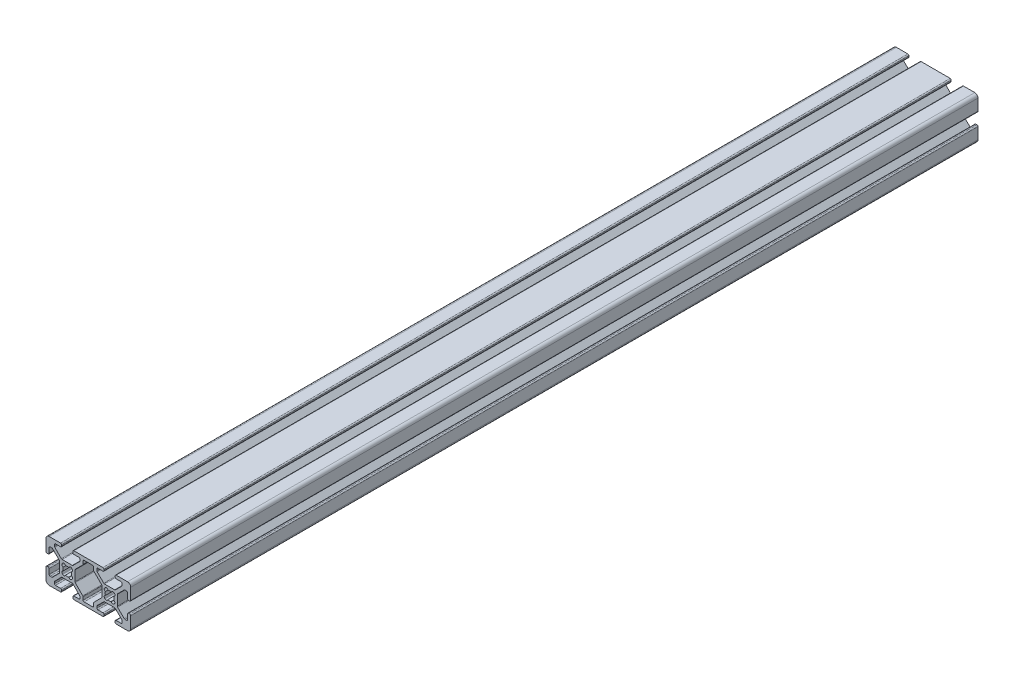
from build123d import *

# Parameters (mm, degrees)
EXTRUDE1_DEPTH = 400


with BuildPart() as part:
    # Sketch1 → Extrude1 (new body)
    with BuildSketch(Plane.XY):
        with BuildLine():
            Line((-22.383919339, -3.655), (-17.616080661, -3.655))
            ThreePointArc((-17.616080661, -3.655), (-17.421677478, -3.693669197), (-17.256870417, -3.803789755))
            Line((-17.256870417, -3.803789755), (-14.153789755, -6.906870417))
            ThreePointArc((-14.153789755, -6.906870417), (-14.043669197, -7.071677478), (-14.005, -7.266080661))
            Line((-14.005, -7.266080661), (-14.005, -7.992))
            ThreePointArc((-14.005, -7.992), (-14.153789755, -8.351210245), (-14.513, -8.5))
            Line((-14.513, -8.5), (-16.862, -8.5))
            ThreePointArc((-16.862, -8.5), (-17.221210245, -8.648789755), (-17.37, -9.008))
            Line((-17.37, -9.008), (-17.37, -9.492))
            ThreePointArc((-17.37, -9.492), (-17.221210245, -9.851210245), (-16.862, -10))
            Line((-16.862, -10), (-3.138, -10))
            ThreePointArc((-3.138, -10), (-2.778789755, -9.851210245), (-2.63, -9.492))
            Line((-2.63, -9.492), (-2.63, -9.008))
            ThreePointArc((-2.63, -9.008), (-2.778789755, -8.648789755), (-3.138, -8.5))
            Line((-3.138, -8.5), (-5.487, -8.5))
            ThreePointArc((-5.487, -8.5), (-5.846210245, -8.351210245), (-5.995, -7.992))
            Line((-5.995, -7.992), (-5.995, -7.266080661))
            ThreePointArc((-5.995, -7.266080661), (-5.956330803, -7.071677478), (-5.846210245, -6.906870417))
            Line((-5.846210245, -6.906870417), (-2.743129583, -3.803789755))
            ThreePointArc((-2.743129583, -3.803789755), (-2.578322522, -3.693669197), (-2.383919339, -3.655))
            Line((-2.383919339, -3.655), (2.383919339, -3.655))
            ThreePointArc((2.383919339, -3.655), (2.578322522, -3.693669197), (2.743129583, -3.803789755))
            Line((2.743129583, -3.803789755), (5.846210245, -6.906870417))
            ThreePointArc((5.846210245, -6.906870417), (5.956330803, -7.071677478), (5.995, -7.266080661))
            Line((5.995, -7.266080661), (5.995, -7.992))
            ThreePointArc((5.995, -7.992), (5.846210245, -8.351210245), (5.487, -8.5))
            Line((5.487, -8.5), (3.138, -8.5))
            ThreePointArc((3.138, -8.5), (2.778789755, -8.648789755), (2.63, -9.008))
            Line((2.63, -9.008), (2.63, -9.492))
            ThreePointArc((2.63, -9.492), (2.778789755, -9.851210245), (3.138, -10))
            Line((3.138, -10), (8.5, -10))
            ThreePointArc((8.5, -10), (9.560660172, -9.560660172), (10, -8.5))
            Line((10, -8.5), (10, -3.138))
            ThreePointArc((10, -3.138), (9.851210245, -2.778789755), (9.492, -2.63))
            Line((9.492, -2.63), (9.008, -2.63))
            ThreePointArc((9.008, -2.63), (8.648789755, -2.778789755), (8.5, -3.138))
            Line((8.5, -3.138), (8.5, -5.487))
            ThreePointArc((8.5, -5.487), (8.351210245, -5.846210245), (7.992, -5.995))
            Line((7.992, -5.995), (7.266080661, -5.995))
            ThreePointArc((7.266080661, -5.995), (7.071677478, -5.956330803), (6.906870417, -5.846210245))
            Line((6.906870417, -5.846210245), (3.803789755, -2.743129583))
            ThreePointArc((3.803789755, -2.743129583), (3.693669197, -2.578322522), (3.655, -2.383919339))
            Line((3.655, -2.383919339), (3.655, 2.383919339))
            ThreePointArc((3.655, 2.383919339), (3.693669197, 2.578322522), (3.803789755, 2.743129583))
            Line((3.803789755, 2.743129583), (6.906870417, 5.846210245))
            ThreePointArc((6.906870417, 5.846210245), (7.071677478, 5.956330803), (7.266080661, 5.995))
            Line((7.266080661, 5.995), (7.992, 5.995))
            ThreePointArc((7.992, 5.995), (8.351210245, 5.846210245), (8.5, 5.487))
            Line((8.5, 5.487), (8.5, 3.138))
            ThreePointArc((8.5, 3.138), (8.648789755, 2.778789755), (9.008, 2.63))
            Line((9.008, 2.63), (9.492, 2.63))
            ThreePointArc((9.492, 2.63), (9.851210245, 2.778789755), (10, 3.138))
            Line((10, 3.138), (10, 8.5))
            ThreePointArc((10, 8.5), (9.560660172, 9.560660172), (8.5, 10))
            Line((8.5, 10), (3.138, 10))
            ThreePointArc((3.138, 10), (2.778789755, 9.851210245), (2.63, 9.492))
            Line((2.63, 9.492), (2.63, 9.008))
            ThreePointArc((2.63, 9.008), (2.778789755, 8.648789755), (3.138, 8.5))
            Line((3.138, 8.5), (5.487, 8.5))
            ThreePointArc((5.487, 8.5), (5.846210245, 8.351210245), (5.995, 7.992))
            Line((5.995, 7.992), (5.995, 7.266080661))
            ThreePointArc((5.995, 7.266080661), (5.956330803, 7.071677478), (5.846210245, 6.906870417))
            Line((5.846210245, 6.906870417), (2.743129583, 3.803789755))
            ThreePointArc((2.743129583, 3.803789755), (2.578322522, 3.693669197), (2.383919339, 3.655))
            Line((2.383919339, 3.655), (-2.383919339, 3.655))
            ThreePointArc((-2.383919339, 3.655), (-2.578322522, 3.693669197), (-2.743129583, 3.803789755))
            Line((-2.743129583, 3.803789755), (-5.846210245, 6.906870417))
            ThreePointArc((-5.846210245, 6.906870417), (-5.956330803, 7.071677478), (-5.995, 7.266080661))
            Line((-5.995, 7.266080661), (-5.995, 7.992))
            ThreePointArc((-5.995, 7.992), (-5.846210245, 8.351210245), (-5.487, 8.5))
            Line((-5.487, 8.5), (-3.138, 8.5))
            ThreePointArc((-3.138, 8.5), (-2.778789755, 8.648789755), (-2.63, 9.008))
            Line((-2.63, 9.008), (-2.63, 9.492))
            ThreePointArc((-2.63, 9.492), (-2.778789755, 9.851210245), (-3.138, 10))
            Line((-3.138, 10), (-16.862, 10))
            ThreePointArc((-16.862, 10), (-17.221210245, 9.851210245), (-17.37, 9.492))
            Line((-17.37, 9.492), (-17.37, 9.008))
            ThreePointArc((-17.37, 9.008), (-17.221210245, 8.648789755), (-16.862, 8.5))
            Line((-16.862, 8.5), (-14.513, 8.5))
            ThreePointArc((-14.513, 8.5), (-14.153789755, 8.351210245), (-14.005, 7.992))
            Line((-14.005, 7.992), (-14.005, 7.266080661))
            ThreePointArc((-14.005, 7.266080661), (-14.043669197, 7.071677478), (-14.153789755, 6.906870417))
            Line((-14.153789755, 6.906870417), (-17.256870417, 3.803789755))
            ThreePointArc((-17.256870417, 3.803789755), (-17.421677478, 3.693669197), (-17.616080661, 3.655))
            Line((-17.616080661, 3.655), (-22.383919339, 3.655))
            ThreePointArc((-22.383919339, 3.655), (-22.578322522, 3.693669197), (-22.743129583, 3.803789755))
            Line((-22.743129583, 3.803789755), (-25.846210245, 6.906870417))
            ThreePointArc((-25.846210245, 6.906870417), (-25.956330803, 7.071677478), (-25.995, 7.266080661))
            Line((-25.995, 7.266080661), (-25.995, 7.992))
            ThreePointArc((-25.995, 7.992), (-25.846210245, 8.351210245), (-25.487, 8.5))
            Line((-25.487, 8.5), (-23.138, 8.5))
            ThreePointArc((-23.138, 8.5), (-22.778789755, 8.648789755), (-22.63, 9.008))
            Line((-22.63, 9.008), (-22.63, 9.492))
            ThreePointArc((-22.63, 9.492), (-22.778789755, 9.851210245), (-23.138, 10))
            Line((-23.138, 10), (-28.5, 10))
            ThreePointArc((-28.5, 10), (-29.560660172, 9.560660172), (-30, 8.5))
            Line((-30, 8.5), (-30, 3.138))
            ThreePointArc((-30, 3.138), (-29.851210245, 2.778789755), (-29.492, 2.63))
            Line((-29.492, 2.63), (-29.008, 2.63))
            ThreePointArc((-29.008, 2.63), (-28.648789755, 2.778789755), (-28.5, 3.138))
            Line((-28.5, 3.138), (-28.5, 5.487))
            ThreePointArc((-28.5, 5.487), (-28.351210245, 5.846210245), (-27.992, 5.995))
            Line((-27.992, 5.995), (-27.266080661, 5.995))
            ThreePointArc((-27.266080661, 5.995), (-27.071677478, 5.956330803), (-26.906870417, 5.846210245))
            Line((-26.906870417, 5.846210245), (-23.803789755, 2.743129583))
            ThreePointArc((-23.803789755, 2.743129583), (-23.693669197, 2.578322522), (-23.655, 2.383919339))
            Line((-23.655, 2.383919339), (-23.655, -2.383919339))
            ThreePointArc((-23.655, -2.383919339), (-23.693669197, -2.578322522), (-23.803789755, -2.743129583))
            Line((-23.803789755, -2.743129583), (-26.906870417, -5.846210245))
            ThreePointArc((-26.906870417, -5.846210245), (-27.071677478, -5.956330803), (-27.266080661, -5.995))
            Line((-27.266080661, -5.995), (-27.992, -5.995))
            ThreePointArc((-27.992, -5.995), (-28.351210245, -5.846210245), (-28.5, -5.487))
            Line((-28.5, -5.487), (-28.5, -3.138))
            ThreePointArc((-28.5, -3.138), (-28.648789755, -2.778789755), (-29.008, -2.63))
            Line((-29.008, -2.63), (-29.492, -2.63))
            ThreePointArc((-29.492, -2.63), (-29.851210245, -2.778789755), (-30, -3.138))
            Line((-30, -3.138), (-30, -8.5))
            ThreePointArc((-30, -8.5), (-29.560660172, -9.560660172), (-28.5, -10))
            Line((-28.5, -10), (-23.138, -10))
            ThreePointArc((-23.138, -10), (-22.778789755, -9.851210245), (-22.63, -9.492))
            Line((-22.63, -9.492), (-22.63, -9.008))
            ThreePointArc((-22.63, -9.008), (-22.778789755, -8.648789755), (-23.138, -8.5))
            Line((-23.138, -8.5), (-25.487, -8.5))
            ThreePointArc((-25.487, -8.5), (-25.846210245, -8.351210245), (-25.995, -7.992))
            Line((-25.995, -7.992), (-25.995, -7.266080661))
            ThreePointArc((-25.995, -7.266080661), (-25.956330803, -7.071677478), (-25.846210245, -6.906870417))
            Line((-25.846210245, -6.906870417), (-22.743129583, -3.803789755))
            ThreePointArc((-22.743129583, -3.803789755), (-22.578322522, -3.693669197), (-22.383919339, -3.655))
        make_face()
        with BuildLine():
            Line((-2.124900844, -2.304505966), (-2.304505966, -2.124900844))
            ThreePointArc((-2.304505966, -2.124900844), (-2.505938017, -1.356467811), (-1.935133506, -0.803976718))
            ThreePointArc((-1.935133506, -0.803976718), (-2.0955, 0), (-1.935133506, 0.803976718))
            ThreePointArc((-1.935133506, 0.803976718), (-2.505938017, 1.356467811), (-2.304505966, 2.124900844))
            Line((-2.304505966, 2.124900844), (-2.124900844, 2.304505966))
            ThreePointArc((-2.124900844, 2.304505966), (-1.356467811, 2.505938017), (-0.803976718, 1.935133506))
            ThreePointArc((-0.803976718, 1.935133506), (0, 2.0955), (0.803976718, 1.935133506))
            ThreePointArc((0.803976718, 1.935133506), (1.356467811, 2.505938017), (2.124900844, 2.304505966))
            Line((2.124900844, 2.304505966), (2.304505966, 2.124900844))
            ThreePointArc((2.304505966, 2.124900844), (2.505938017, 1.356467811), (1.935133506, 0.803976718))
            ThreePointArc((1.935133506, 0.803976718), (2.0955, 0), (1.935133506, -0.803976718))
            ThreePointArc((1.935133506, -0.803976718), (2.505938017, -1.356467811), (2.304505966, -2.124900844))
            Line((2.304505966, -2.124900844), (2.124900844, -2.304505966))
            ThreePointArc((2.124900844, -2.304505966), (1.356467811, -2.505938017), (0.803976718, -1.935133506))
            ThreePointArc((0.803976718, -1.935133506), (0, -2.0955), (-0.803976718, -1.935133506))
            ThreePointArc((-0.803976718, -1.935133506), (-1.356467811, -2.505938017), (-2.124900844, -2.304505966))
        make_face(mode=Mode.SUBTRACT)
        with BuildLine():
            Line((-12.505, -7.992), (-12.505, -6.644760318))
            ThreePointArc((-12.505, -6.644760318), (-12.543669197, -6.450357134), (-12.653789755, -6.285550073))
            Line((-12.653789755, -6.285550073), (-16.196210245, -2.743129583))
            ThreePointArc((-16.196210245, -2.743129583), (-16.306330803, -2.578322522), (-16.345, -2.383919339))
            Line((-16.345, -2.383919339), (-16.345, 2.383919339))
            ThreePointArc((-16.345, 2.383919339), (-16.306330803, 2.578322522), (-16.196210245, 2.743129583))
            Line((-16.196210245, 2.743129583), (-12.653789755, 6.285550073))
            ThreePointArc((-12.653789755, 6.285550073), (-12.543669197, 6.450357134), (-12.505, 6.644760318))
            Line((-12.505, 6.644760318), (-12.505, 7.992))
            ThreePointArc((-12.505, 7.992), (-12.356210245, 8.351210245), (-11.997, 8.5))
            Line((-11.997, 8.5), (-8.003, 8.5))
            ThreePointArc((-8.003, 8.5), (-7.643789755, 8.351210245), (-7.495, 7.992))
            Line((-7.495, 7.992), (-7.495, 6.644760318))
            ThreePointArc((-7.495, 6.644760318), (-7.456330803, 6.450357134), (-7.346210245, 6.285550073))
            Line((-7.346210245, 6.285550073), (-3.803789755, 2.743129583))
            ThreePointArc((-3.803789755, 2.743129583), (-3.693669197, 2.578322522), (-3.655, 2.383919339))
            Line((-3.655, 2.383919339), (-3.655, -2.383919339))
            ThreePointArc((-3.655, -2.383919339), (-3.693669197, -2.578322522), (-3.803789755, -2.743129583))
            Line((-3.803789755, -2.743129583), (-7.346210245, -6.285550073))
            ThreePointArc((-7.346210245, -6.285550073), (-7.456330803, -6.450357134), (-7.495, -6.644760318))
            Line((-7.495, -6.644760318), (-7.495, -7.992))
            ThreePointArc((-7.495, -7.992), (-7.643789755, -8.351210245), (-8.003, -8.5))
            Line((-8.003, -8.5), (-11.997, -8.5))
            ThreePointArc((-11.997, -8.5), (-12.356210245, -8.351210245), (-12.505, -7.992))
        make_face(mode=Mode.SUBTRACT)
        with BuildLine():
            Line((-22.124900844, -2.304505966), (-22.304505966, -2.124900844))
            ThreePointArc((-22.304505966, -2.124900844), (-22.505938017, -1.356467811), (-21.935133506, -0.803976718))
            ThreePointArc((-21.935133506, -0.803976718), (-22.0955, 0), (-21.935133506, 0.803976718))
            ThreePointArc((-21.935133506, 0.803976718), (-22.505938017, 1.356467811), (-22.304505966, 2.124900844))
            Line((-22.304505966, 2.124900844), (-22.124900844, 2.304505966))
            ThreePointArc((-22.124900844, 2.304505966), (-21.356467811, 2.505938017), (-20.803976718, 1.935133506))
            ThreePointArc((-20.803976718, 1.935133506), (-20, 2.0955), (-19.196023282, 1.935133506))
            ThreePointArc((-19.196023282, 1.935133506), (-18.643532189, 2.505938017), (-17.875099156, 2.304505966))
            Line((-17.875099156, 2.304505966), (-17.695494034, 2.124900844))
            ThreePointArc((-17.695494034, 2.124900844), (-17.494061983, 1.356467811), (-18.064866494, 0.803976718))
            ThreePointArc((-18.064866494, 0.803976718), (-17.9045, 0), (-18.064866494, -0.803976718))
            ThreePointArc((-18.064866494, -0.803976718), (-17.494061983, -1.356467811), (-17.695494034, -2.124900844))
            Line((-17.695494034, -2.124900844), (-17.875099156, -2.304505966))
            ThreePointArc((-17.875099156, -2.304505966), (-18.643532189, -2.505938017), (-19.196023282, -1.935133506))
            ThreePointArc((-19.196023282, -1.935133506), (-20, -2.0955), (-20.803976718, -1.935133506))
            ThreePointArc((-20.803976718, -1.935133506), (-21.356467811, -2.505938017), (-22.124900844, -2.304505966))
        make_face(mode=Mode.SUBTRACT)
    extrude(amount=-EXTRUDE1_DEPTH)


solid = part.part
